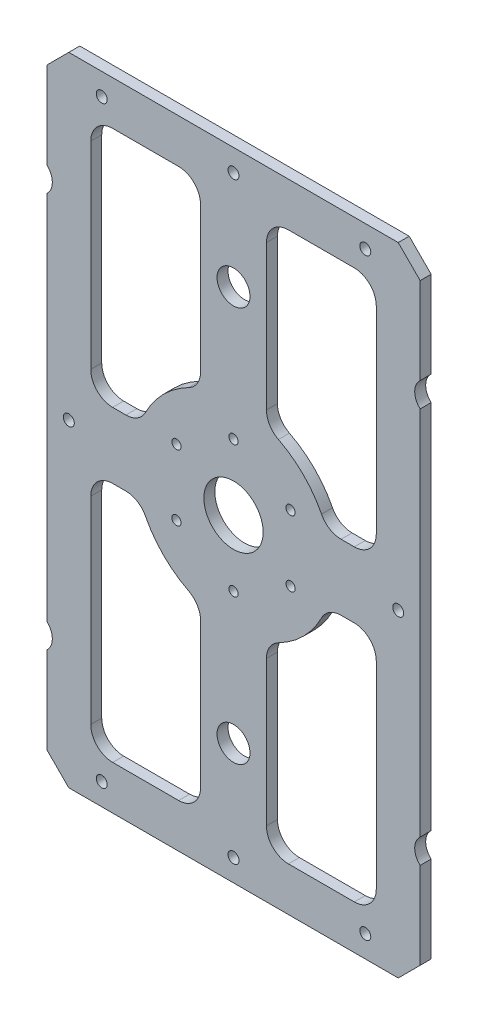
from build123d import *

# Parameters (mm, degrees)
SKETCH_1_W          = 170
SKETCH_1_H          = 290
EXTRUDE_1_DEPTH     = 5
SKETCH_2_R          = 13.5
CUT_EXTRUDE_1_DEPTH = 169.151717208
SKETCH_3_R          = 2.5
CUT_EXTRUDE_2_DEPTH = 169.151717208
CHAMFER_1_SIZE      = 10
SKETCH_4_R          = 7.5
SKETCH_4_R_2        = 2.1
CUT_EXTRUDE_3_DEPTH = 169.151717208
CUT_EXTRUDE_4_DEPTH = 169.151717208
FILLET_1_R          = 10


with BuildPart() as part:
    # ｽｹｯﾁ1 → ﾎﾞｽ - 押し出し1 (new body)
    with BuildSketch(Plane.XY):
        Rectangle(SKETCH_1_W, SKETCH_1_H)
    extrude(amount=EXTRUDE_1_DEPTH)

    # ｽｹｯﾁ2 → ｶｯﾄ - 押し出し1 (cut, through all)
    with BuildSketch(Plane.XY.offset(5)):
        Circle(SKETCH_2_R)
    extrude(amount=-CUT_EXTRUDE_1_DEPTH, mode=Mode.SUBTRACT)

    # ｽｹｯﾁ3 → ｶｯﾄ - 押し出し2 (cut, through all)
    with BuildSketch(Plane.XY.offset(5)):
        with Locations((-75, 0)):
            Circle(SKETCH_3_R)
        with Locations((0, 135)):
            Circle(SKETCH_3_R)
        with Locations((75, 0)):
            Circle(SKETCH_3_R)
        with Locations((0, -135)):
            Circle(SKETCH_3_R)
        with Locations((-60, 135)):
            Circle(SKETCH_3_R)
        with Locations((60, 135)):
            Circle(SKETCH_3_R)
        with Locations((60, -135)):
            Circle(SKETCH_3_R)
        with Locations((-60, -135)):
            Circle(SKETCH_3_R)
    extrude(amount=-CUT_EXTRUDE_2_DEPTH, mode=Mode.SUBTRACT)

    # 面取り1
    chamfer_1_edges = [part.edges().sort_by_distance(p)[0] for p in [
        (85, -145, 2.5),
        (-85, -145, 2.5),
        (-85, 145, 2.5),
        (85, 145, 2.5),
    ]]
    chamfer(chamfer_1_edges, length=CHAMFER_1_SIZE)

    # ｽｹｯﾁ4 → ｶｯﾄ - 押し出し3 (cut, through all)
    with BuildSketch(Plane.XY.offset(5)):
        with Locations((90, 90)):
            Circle(SKETCH_4_R)
        with Locations((0, 90)):
            Circle(SKETCH_4_R)
        with Locations((-90, 90)):
            Circle(SKETCH_4_R)
        with Locations((-90, -90)):
            Circle(SKETCH_4_R)
        with Locations((0, -90)):
            Circle(SKETCH_4_R)
        with Locations((90, -90)):
            Circle(SKETCH_4_R)
        with Locations((0, -30)):
            Circle(SKETCH_4_R_2)
        with Locations((-25.980762114, -15)):
            Circle(SKETCH_4_R_2)
        with Locations((-25.980762114, 15)):
            Circle(SKETCH_4_R_2)
        with Locations((0, 30)):
            Circle(SKETCH_4_R_2)
        with Locations((25.980762114, 15)):
            Circle(SKETCH_4_R_2)
        with Locations((25.980762114, -15)):
            Circle(SKETCH_4_R_2)
    extrude(amount=-CUT_EXTRUDE_3_DEPTH, mode=Mode.SUBTRACT)

    # ｽｹｯﾁ5 → ｶｯﾄ - 押し出し4 (cut, through all)
    with BuildSketch(Plane.XY.offset(5)):
        with BuildLine():
            Line((-65, 125), (-65, 15))
            Line((-65, 15), (-42.426406871, 15))
            ThreePointArc((-42.426406871, 15), (-31.819805153, 31.819805153), (-15, 42.426406871))
            Line((-15, 42.426406871), (-15, 125))
            Line((-15, 125), (-65, 125))
        make_face()
        with BuildLine():
            Line((15, 42.426406871), (15, 125))
            Line((15, 125), (65, 125))
            Line((65, 125), (65, 15))
            Line((65, 15), (42.426406871, 15))
            ThreePointArc((42.426406871, 15), (31.819805153, 31.819805153), (15, 42.426406871))
        make_face()
        with BuildLine():
            Line((-15, -42.426406871), (-15, -125))
            Line((-15, -125), (-65, -125))
            Line((-65, -125), (-65, -15))
            Line((-65, -15), (-42.426406871, -15))
            ThreePointArc((-42.426406871, -15), (-31.819805153, -31.819805153), (-15, -42.426406871))
        make_face()
        with BuildLine():
            Line((15, -42.426406871), (15, -125))
            Line((15, -125), (65, -125))
            Line((65, -125), (65, -15))
            Line((65, -15), (42.426406871, -15))
            ThreePointArc((42.426406871, -15), (31.819805153, -31.819805153), (15, -42.426406871))
        make_face()
    extrude(amount=-CUT_EXTRUDE_4_DEPTH, mode=Mode.SUBTRACT)

    # ﾌｨﾚｯﾄ1
    fillet_1_edges = [part.edges().sort_by_distance(p)[0] for p in [
        (-65, -15, 2.5),
        (-15, -125, 2.5),
        (-65, -125, 2.5),
        (-15, -42.426406871, 2.5),
        (-42.426406871, -15, 2.5),
        (15, -125, 2.5),
        (15, -42.426406871, 2.5),
        (42.426406871, -15, 2.5),
        (65, -15, 2.5),
        (65, -125, 2.5),
        (65, 15, 2.5),
        (65, 125, 2.5),
        (15, 125, 2.5),
        (42.426406871, 15, 2.5),
        (15, 42.426406871, 2.5),
        (-15, 42.426406871, 2.5),
        (-42.426406871, 15, 2.5),
        (-65, 15, 2.5),
        (-15, 125, 2.5),
        (-65, 125, 2.5),
    ]]
    fillet(fillet_1_edges, radius=FILLET_1_R)


solid = part.part
